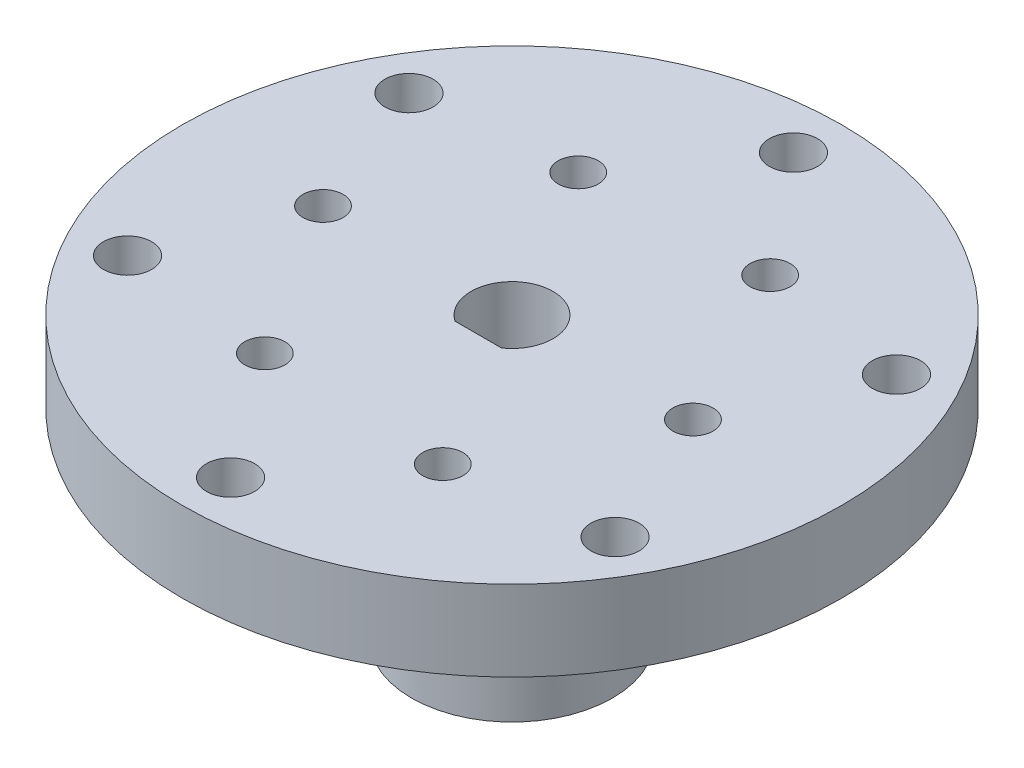
from build123d import *

# Parameters (mm, degrees)
SKETCH1_R               = 12.5
SKETCH1_R_2             = 5.1
BOSS_EXTRUDE1_DEPTH     = 15
SKETCH2_R               = 41
SKETCH2_R_2             = 5.1
BOSS_EXTRUDE2_DEPTH     = 20
SKETCH3_R               = 3
CUT_EXTRUDE1_DEPTH      = 68.727394753
BOSS_EXTRUDE3_DEPTH     = 35
CUT_EXTRUDE2_DEPTH      = 71.349413644
CUT_EXTRUDE2_DEPTH_BACK = 71.349413644
SKETCH5_R               = 1.5
SKETCH6_R               = 41
SKETCH6_R_2             = 12.5
CUT_EXTRUDE3_DEPTH      = 10
SKETCH8_R               = 2.5
CUT_EXTRUDE4_DEPTH      = 68.727394804


with BuildPart() as part:
    # Sketch1 → Boss-Extrude1 (new body)
    with BuildSketch(Plane(origin=(0, 0, 0), x_dir=(1, 0, 0), z_dir=(0, 1, 0))):
        Circle(SKETCH1_R)
        Circle(SKETCH1_R_2, mode=Mode.SUBTRACT)
    extrude(amount=BOSS_EXTRUDE1_DEPTH)

    # Sketch2 → Boss-Extrude2 (add)
    with BuildSketch(Plane(origin=(0, 15, 0), x_dir=(1, 0, 0), z_dir=(0, 1, 0))):
        Circle(SKETCH2_R)
        Circle(SKETCH2_R_2, mode=Mode.SUBTRACT)
    extrude(amount=BOSS_EXTRUDE2_DEPTH)

    # Sketch3 → Cut-Extrude1 (cut, through all)
    with BuildSketch(Plane(origin=(0, 35, 0), x_dir=(1, 0, 0), z_dir=(0, 1, 0))):
        with Locations((0, 35)):
            Circle(SKETCH3_R)
        with Locations((30.310889132, 17.5)):
            Circle(SKETCH3_R)
        with Locations((30.310889132, -17.5)):
            Circle(SKETCH3_R)
        with Locations((0, -35)):
            Circle(SKETCH3_R)
        with Locations((-30.310889132, -17.5)):
            Circle(SKETCH3_R)
        with Locations((-30.310889132, 17.5)):
            Circle(SKETCH3_R)
    extrude(amount=-CUT_EXTRUDE1_DEPTH, mode=Mode.SUBTRACT)

    # Sketch4 → Boss-Extrude3 (add)
    with BuildSketch(Plane.XZ):
        with BuildLine():
            ThreePointArc((2.893095228, 4.2), (0, 5.1), (-2.893095228, 4.2))
            Line((-2.893095228, 4.2), (2.893095228, 4.2))
        make_face()
    extrude(amount=-BOSS_EXTRUDE3_DEPTH)

    # Sketch5 → Cut-Extrude2 (cut, two sides: drawn at the far end of the back side and taken through both)
    with BuildSketch(Plane(origin=(0, 0, 4.2), x_dir=(-1, 0, 0), z_dir=(0, 0, -1)).offset(-CUT_EXTRUDE2_DEPTH_BACK)):
        with Locations((0, 9)):
            Circle(SKETCH5_R)
    extrude(amount=CUT_EXTRUDE2_DEPTH + CUT_EXTRUDE2_DEPTH_BACK, mode=Mode.SUBTRACT)

    # Sketch6 → Cut-Extrude3 (cut)
    with BuildSketch(Plane.XZ.offset(-15)):
        Circle(SKETCH6_R)
        Circle(SKETCH6_R_2, mode=Mode.SUBTRACT)
    extrude(amount=-CUT_EXTRUDE3_DEPTH, mode=Mode.SUBTRACT)

    # Sketch8 → Cut-Extrude4 (cut, through all)
    with BuildSketch(Plane.XZ):
        with Locations((22.5, 0)):
            Circle(SKETCH8_R)
        with Locations((-23.5, 0)):
            Circle(SKETCH8_R)
        with Locations((-11.25, -19.485571585)):
            Circle(SKETCH8_R)
        with Locations((-11.25, 19.485571585)):
            Circle(SKETCH8_R)
        with Locations((11.75, 20.351596989)):
            Circle(SKETCH8_R)
        with Locations((11.75, -20.351596989)):
            Circle(SKETCH8_R)
    extrude(amount=-CUT_EXTRUDE4_DEPTH, mode=Mode.SUBTRACT)


solid = part.part
